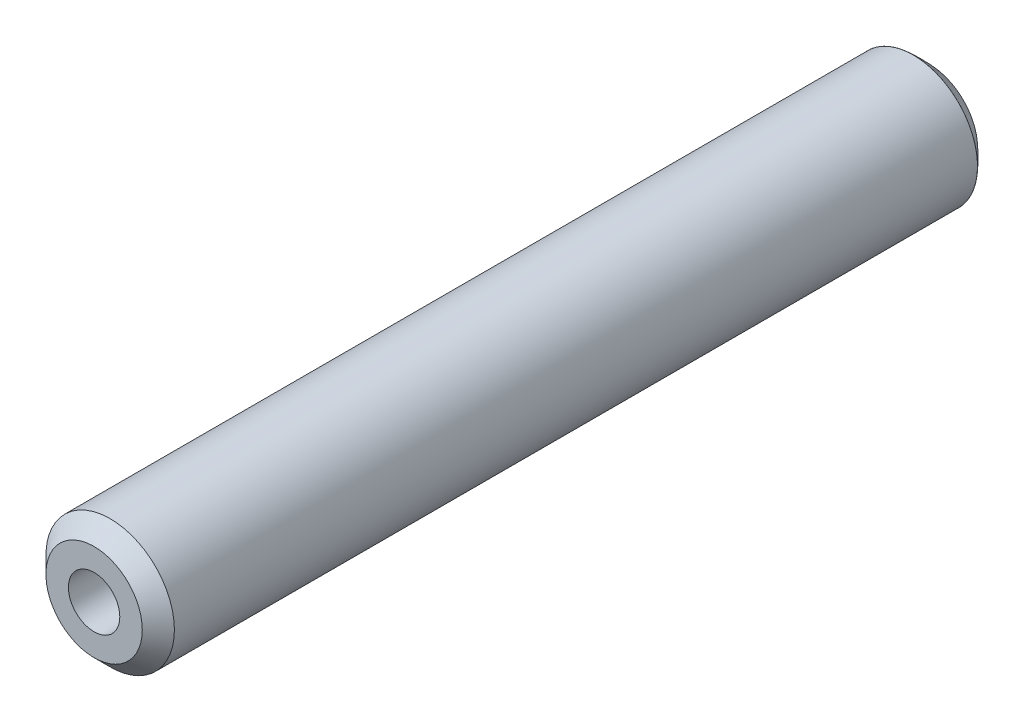
from build123d import *

# Parameters (mm, degrees)
SKETCH_2_W             = 38
SKETCH_2_H             = 39
EXTRUDE_1_DEPTH        = 2
CHAMFER_3_SIZE         = 1
SKETCH_7_R             = 4.25
CUT_EXTRUDE_3_DEPTH    = 10
SKETCH_8_W             = 2
SKETCH_8_H             = 39
CUT_EXTRUDE_4_DEPTH    = 10
FILLET_3_R             = 2
SKETCH_9_R             = 2
EXTRUDE_1_2_DEPTH      = 26
SKETCH_10_W            = 3
SKETCH_10_H            = 39
CUT_EXTRUDE_1_DEPTH    = 10
FILLET_5_R             = 2
CHAMFER_5_SIZE         = 0.5
HOLE_WIZARD_M2_5_3_D   = 2.05
HOLE_WIZARD_M2_1_D     = 1.6
HOLE_WIZARD_M2_1_DEPTH = 7
HOLE_WIZARD_M2_1_TIP   = 0.480688495
CUT_EXTRUDE_2_DEPTH    = 10
SKETCH_24_W            = 71.290640242
SKETCH_24_H            = 51.144653494
CUT_EXTRUDE_3_2_DEPTH  = 10
SKETCH_25_R            = 6.539265834
CUT_EXTRUDE_4_2_DEPTH  = 32
HOLE_WIZARD_M2_2_D     = 1.6
HOLE_WIZARD_M2_2_DEPTH = 7
HOLE_WIZARD_M2_2_TIP   = 0.480688495
FILLET_6_SIZE          = 0.5


with BuildPart() as part:
    # 草图2 → Extrude 1 (new body)
    with BuildSketch(Plane.XY):
        Rectangle(SKETCH_2_W, SKETCH_2_H)
    extrude(amount=EXTRUDE_1_DEPTH)

    # 倒角3
    chamfer_3_edges = [part.edges().sort_by_distance(p)[0] for p in [
        (-19, 19.5, 1),
        (-19, -19.5, 1),
    ]]
    chamfer(chamfer_3_edges, length=CHAMFER_3_SIZE)

    # 草图7 → Cut-Extrude 3 (cut)
    with BuildSketch(Plane.XY.offset(2)):
        with Locations((2, 0)):
            Circle(SKETCH_7_R)
    extrude(amount=-CUT_EXTRUDE_3_DEPTH, mode=Mode.SUBTRACT)

    # 草图8 → Cut-Extrude 4 (cut)
    with BuildSketch(Plane.XY.offset(2)):
        with Locations((-18, 0)):
            Rectangle(SKETCH_8_W, SKETCH_8_H)
    extrude(amount=-CUT_EXTRUDE_4_DEPTH, mode=Mode.SUBTRACT)

    # 圆角3
    fillet_3_edges = [part.edges().sort_by_distance(p)[0] for p in [
        (-17, 19.5, 1),
        (-17, -19.5, 1),
    ]]
    fillet(fillet_3_edges, radius=FILLET_3_R)

    # 草图9 → Extrude 1 2 (add)
    with BuildSketch(Plane.XY.offset(2)):
        with Locations((-15, 17.5)):
            Circle(SKETCH_9_R)
        with Locations((-15, -17.5)):
            Circle(SKETCH_9_R)
    extrude_1_2 = extrude(amount=EXTRUDE_1_2_DEPTH)

    # 镜向1: Extrude 1 2 across plane
    add(extrude_1_2.mirror(Plane.ZX))

    # 草图10 → 切除-拉伸1 (cut)
    with BuildSketch(Plane(origin=(0, 0, 0), x_dir=(-1, 0, 0), z_dir=(0, 0, -1))):
        with Locations((-17.5, 0)):
            Rectangle(SKETCH_10_W, SKETCH_10_H)
    extrude(amount=-CUT_EXTRUDE_1_DEPTH, mode=Mode.SUBTRACT)

    # 圆角5
    fillet_5_edges = [part.edges().sort_by_distance(p)[0] for p in [
        (16, -19.5, 1),
        (16, 19.5, 1),
    ]]
    fillet(fillet_5_edges, radius=FILLET_5_R)

    # 倒角5
    chamfer_5_edges = [part.edges().sort_by_distance(p)[0] for p in [
        (-17, -17.5, 28),
        (-17, 17.5, 28),
        (15.414213562, 18.914213562, 0),
        (16, 0, 0),
        (-0.5, 19.5, 0),
        (15.414213562, -18.914213562, 0),
        (-16.414213562, 18.914213562, 0),
        (-0.5, -19.5, 0),
        (-17, 0, 0),
        (-16.414213562, -18.914213562, 0),
    ]]
    chamfer(chamfer_5_edges, length=CHAMFER_5_SIZE)

    # M2.5 螺纹孔3 (through all)
    with Locations(Plane(origin=(9.5, 15.5, 0), x_dir=(-1, 0, 0), z_dir=(0, 0, -1))):
        with Locations((0, 0), (15, 0), (0, -31), (15, -31)):
            Hole(HOLE_WIZARD_M2_5_3_D / 2)

    # M2 螺纹孔1
    with Locations(Plane(origin=(-15, 17.5, 28), x_dir=(1, 0, 0), z_dir=(0, 0, 1))):
        with Locations((0, 0), (0, -35)):
            Hole(HOLE_WIZARD_M2_1_D / 2, depth=HOLE_WIZARD_M2_1_DEPTH)
            with Locations((0, 0, -(HOLE_WIZARD_M2_1_DEPTH + HOLE_WIZARD_M2_1_TIP / 2))):  # 118° drill point
                Cone(0, HOLE_WIZARD_M2_1_D / 2, HOLE_WIZARD_M2_1_TIP, mode=Mode.SUBTRACT)

    # 草图23 → 切除-拉伸2 (cut)
    with BuildSketch(Plane(origin=(0, 0, 0), x_dir=(-1, 0, 0), z_dir=(0, 0, -1))):
        with BuildLine():
            Line((-0.95, 16.2), (-0.95, 9.8))
            ThreePointArc((-0.95, 9.8), (-2, 8.75), (-3.05, 9.8))
            Line((-3.05, 9.8), (-3.05, 16.2))
            ThreePointArc((-3.05, 16.2), (-2, 17.25), (-0.95, 16.2))
        make_face()
    cut_extrude_2 = extrude(amount=-CUT_EXTRUDE_2_DEPTH, mode=Mode.SUBTRACT)

    # 镜向2: 切除-拉伸2 across plane
    add(cut_extrude_2.mirror(Plane.ZX), mode=Mode.SUBTRACT)

    # 草图24 → Cut-Extrude 3 2 (cut)
    with BuildSketch(Plane.XY.offset(2)):
        Rectangle(SKETCH_24_W, SKETCH_24_H)
    extrude(amount=-CUT_EXTRUDE_3_2_DEPTH, mode=Mode.SUBTRACT)


with BuildPart() as cut_extrude_3_2_piece_1:
    # of the separate pieces the step leaves, piece 1, a body of its own (cut_extrude_3_2_pieces)
    add(part.part.solids().sort_by_distance((-13, 17.5, 27.5))[0])

    # 草图25 → Cut-Extrude 4 2 (cut)
    with BuildSketch(Plane(origin=(0, 0, 2), x_dir=(-1, 0, 0), z_dir=(0, 0, -1))):
        with Locations((15, 17.5)):
            Circle(SKETCH_25_R)
    extrude(amount=-CUT_EXTRUDE_4_2_DEPTH, mode=Mode.SUBTRACT)


with BuildPart() as cut_extrude_3_2_piece_2:
    # of the separate pieces the step leaves, piece 2, a body of its own (cut_extrude_3_2_pieces)
    add(part.part.solids().sort_by_distance((-13, -17.5, 2))[0])

    # M2 螺纹孔2
    with Locations(Plane(origin=(-15, -17.5, 2), x_dir=(-1, 0, 0), z_dir=(0, 0, -1))):
        with Locations((0, 0)):
            Hole(HOLE_WIZARD_M2_2_D / 2, depth=HOLE_WIZARD_M2_2_DEPTH)
            with Locations((0, 0, -(HOLE_WIZARD_M2_2_DEPTH + HOLE_WIZARD_M2_2_TIP / 2))):  # 118° drill point
                Cone(0, HOLE_WIZARD_M2_2_D / 2, HOLE_WIZARD_M2_2_TIP, mode=Mode.SUBTRACT)

    # 圆角6
    # a fillet whose section is not a circle: 0.5 mm, written as the material it takes off along each edge
    with BuildSketch(Plane(origin=(-15, -17.5, 2), x_dir=(1, 0, 0), z_dir=(0, -1, 0))) as fillet_6_piece_1:
        with BuildLine():
            Bezier((2, FILLET_6_SIZE), (2, 0), (2 - FILLET_6_SIZE, 0), weights=[1, 0.035355339, 1])
            Line((2 - FILLET_6_SIZE, 0), (2, 0))
            Line((2, 0), (2, FILLET_6_SIZE))
        make_face()
    revolve(axis=Axis((-15, -17.5, 2), (0, 0, 1)), mode=Mode.SUBTRACT)


solid = cut_extrude_3_2_piece_2.part
